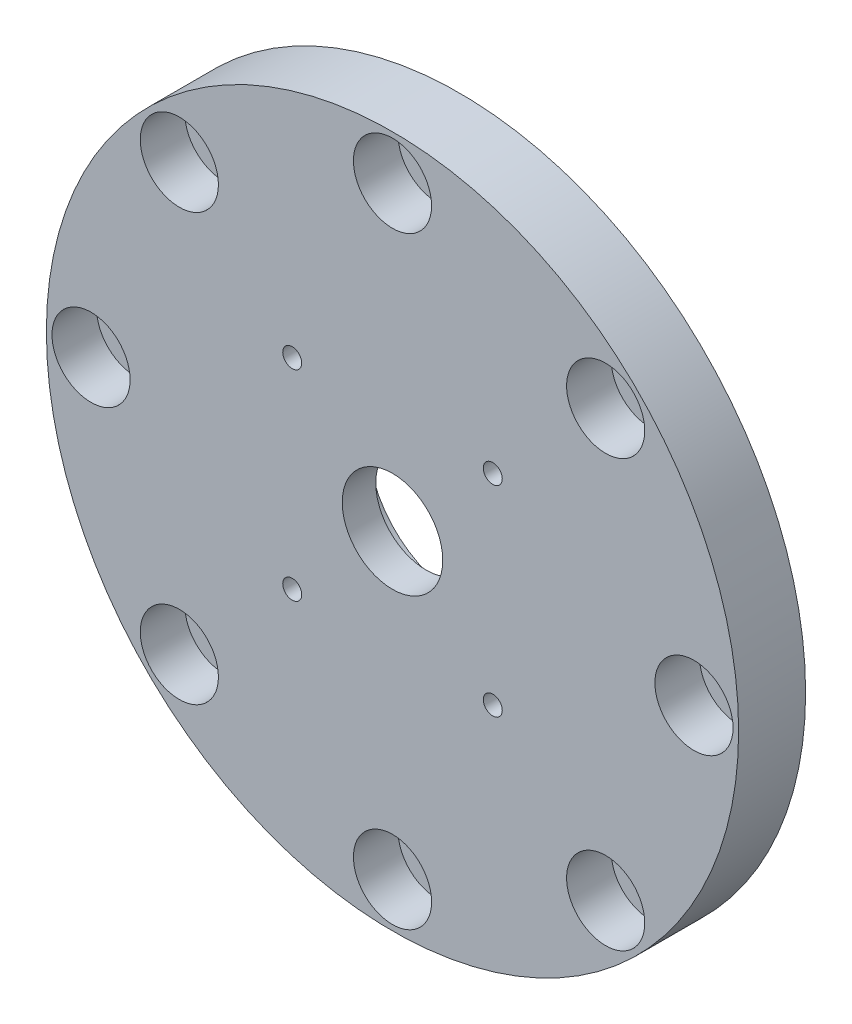
from build123d import *

# Parameters (mm, degrees)
SKETCH1_R           = 31
SKETCH1_R_2         = 4.5
SKETCH1_R_3         = 0.85
SKETCH1_R_4         = 1.55
BOSS_EXTRUDE2_DEPTH = 6
SKETCH5_R           = 8.2
CUT_EXTRUDE3_DEPTH  = 3
SKETCH6_R           = 3.5
CUT_EXTRUDE4_DEPTH  = 4
CUT_EXTRUDE5_DEPTH  = 2


with BuildPart() as part:
    # Sketch1 → Boss-Extrude2 (new body)
    with BuildSketch(Plane.XY):
        Circle(SKETCH1_R)
        Circle(SKETCH1_R_2, mode=Mode.SUBTRACT)
        with Locations((8.980256121, 8.980256121)):
            Circle(SKETCH1_R_3, mode=Mode.SUBTRACT)
        with Locations((8.980256121, -8.980256121)):
            Circle(SKETCH1_R_3, mode=Mode.SUBTRACT)
        with Locations((-8.980256121, -8.980256121)):
            Circle(SKETCH1_R_3, mode=Mode.SUBTRACT)
        with Locations((-8.980256121, 8.980256121)):
            Circle(SKETCH1_R_3, mode=Mode.SUBTRACT)
        with Locations((-27, 0)):
            Circle(SKETCH1_R_4, mode=Mode.SUBTRACT)
        with Locations((-19.091883092, 19.091883092)):
            Circle(SKETCH1_R_4, mode=Mode.SUBTRACT)
        with Locations((0, 27)):
            Circle(SKETCH1_R_4, mode=Mode.SUBTRACT)
        with Locations((19.091883092, 19.091883092)):
            Circle(SKETCH1_R_4, mode=Mode.SUBTRACT)
        with Locations((27, 0)):
            Circle(SKETCH1_R_4, mode=Mode.SUBTRACT)
        with Locations((19.091883092, -19.091883092)):
            Circle(SKETCH1_R_4, mode=Mode.SUBTRACT)
        with Locations((0, -27)):
            Circle(SKETCH1_R_4, mode=Mode.SUBTRACT)
        with Locations((-19.091883092, -19.091883092)):
            Circle(SKETCH1_R_4, mode=Mode.SUBTRACT)
    extrude(amount=BOSS_EXTRUDE2_DEPTH)

    # Sketch5 → Cut-Extrude3 (cut)
    with BuildSketch(Plane(origin=(0, 0, 0), x_dir=(-1, 0, 0), z_dir=(0, 0, -1))):
        Circle(SKETCH5_R)
    extrude(amount=-CUT_EXTRUDE3_DEPTH, mode=Mode.SUBTRACT)

    # Sketch6 → Cut-Extrude4 (cut)
    with BuildSketch(Plane.XY.offset(6)):
        with Locations((0, 27)):
            Circle(SKETCH6_R)
        with Locations((19.091883092, 19.091883092)):
            Circle(SKETCH6_R)
        with Locations((27, 0)):
            Circle(SKETCH6_R)
        with Locations((19.091883092, -19.091883092)):
            Circle(SKETCH6_R)
        with Locations((0, -27)):
            Circle(SKETCH6_R)
        with Locations((-19.091883092, -19.091883092)):
            Circle(SKETCH6_R)
        with Locations((-27, 0)):
            Circle(SKETCH6_R)
        with Locations((-19.091883092, 19.091883092)):
            Circle(SKETCH6_R)
    extrude(amount=-CUT_EXTRUDE4_DEPTH, mode=Mode.SUBTRACT)

    # Sketch7 → Cut-Extrude5 (cut)
    with BuildSketch(Plane(origin=(0, 0, 0), x_dir=(-1, 0, 0), z_dir=(0, 0, -1))):
        Polygon((-6.936436168, 10.160256121), (-8.980256121, 11.340256121), (-11.024076074, 10.160256121), (-11.024076074, 7.800256121), (-8.980256121, 6.620256121), (-6.936436168, 7.800256121), align=None)
        Polygon((10.160256121, 6.936436168), (11.340256121, 8.980256121), (10.160256121, 11.024076074), (7.800256121, 11.024076074), (6.620256121, 8.980256121), (7.800256121, 6.936436168), align=None)
        Polygon((6.936436168, -10.160256121), (8.980256121, -11.340256121), (11.024076074, -10.160256121), (11.024076074, -7.800256121), (8.980256121, -6.620256121), (6.936436168, -7.800256121), align=None)
        Polygon((-10.160256121, -6.936436168), (-11.340256121, -8.980256121), (-10.160256121, -11.024076074), (-7.800256121, -11.024076074), (-6.620256121, -8.980256121), (-7.800256121, -6.936436168), align=None)
    extrude(amount=-CUT_EXTRUDE5_DEPTH, mode=Mode.SUBTRACT)


solid = part.part
